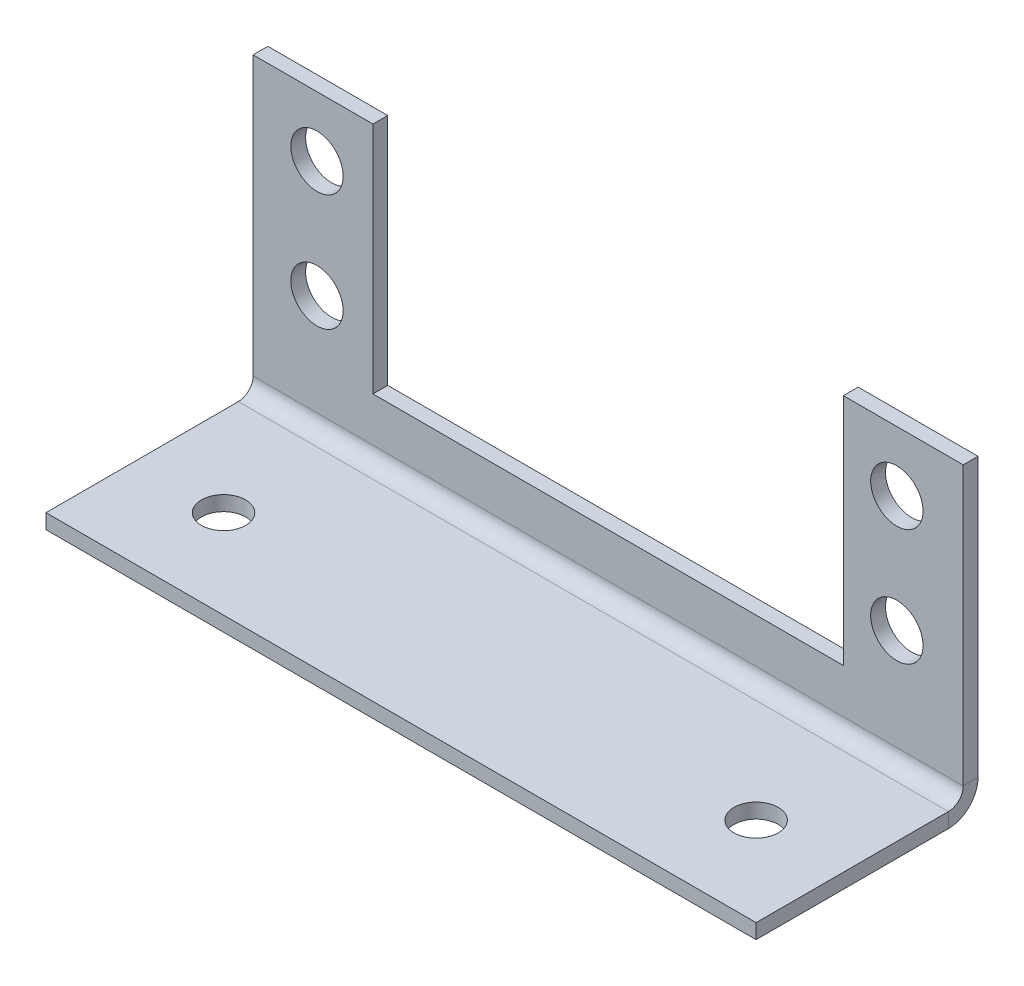
from build123d import *

# Parameters (mm, degrees)
BOSS_EXTRUDE1_DEPTH    = 60.96
CONVERT_SOLID1_DEPTH   = 60.96
CONVERT_SOLID1_2_DEPTH = 60.96
SKETCH6_W              = 40.386
SKETCH6_H              = 20.066
CUT_EXTRUDE1_DEPTH     = 71.995158286
SKETCH8_R              = 1.89865
CUT_EXTRUDE2_DEPTH     = 71.767609116
SKETCH9_R              = 2.2479
CUT_EXTRUDE3_DEPTH     = 71.995158286
CUT_EXTRUDE4_DEPTH     = 71.995158286


# Read off the part's stored shape, not the designer's step: Convert-Solid1
with BuildPart() as part:
    # Sketch1 → Boss-Extrude1 (new body)
    with BuildSketch(Plane(origin=(0, 0, 0), x_dir=(0, 0, -1), z_dir=(1, 0, 0))):
        Polygon((0, 0), (19.05, 0), (19.05, 31.75), (17.78, 31.75), (17.78, 1.27), (0, 1.27), align=None)
    extrude(amount=BOSS_EXTRUDE1_DEPTH)

    # Convert-Solid1 outline → Convert-Solid1 (cut)
    with BuildSketch(Plane.YZ):
        with BuildLine():
            ThreePointArc((2.54, -19.05), (0.743948776, -18.306051224), (0, -16.51))
            Line((0, -16.51), (0, -19.05))
            Line((0, -19.05), (2.54, -19.05))
        make_face()
    extrude(amount=CONVERT_SOLID1_DEPTH, mode=Mode.SUBTRACT)

    # Convert-Solid1 2 outline → Convert-Solid1 2 (add)
    with BuildSketch(Plane.YZ):
        with BuildLine():
            ThreePointArc((2.54, -17.78), (1.641974388, -17.408025612), (1.27, -16.51))
            Line((1.27, -16.51), (1.27, -17.78))
            Line((1.27, -17.78), (2.54, -17.78))
        make_face()
    extrude(amount=CONVERT_SOLID1_2_DEPTH)

    # Sketch6 → Cut-Extrude1 (cut, through all)
    with BuildSketch(Plane.XY.offset(-17.78)):
        with Locations((30.48, 16.383)):
            Rectangle(SKETCH6_W, SKETCH6_H)
    extrude(amount=-CUT_EXTRUDE1_DEPTH, mode=Mode.SUBTRACT)

    # Sketch8 → Cut-Extrude2 (cut, through all)
    with BuildSketch(Plane(origin=(0, 1.27, 0), x_dir=(1, 0, 0), z_dir=(0, 1, 0))):
        with Locations(Location((7.62, 7.62, 0), (0, 0, 270))):
            Circle(SKETCH8_R)
        with Locations(Location((53.34, 7.62, 0), (0, 0, 270))):
            Circle(SKETCH8_R)
    extrude(amount=-CUT_EXTRUDE2_DEPTH, mode=Mode.SUBTRACT)

    # Sketch9 → Cut-Extrude3 (cut, through all)
    with BuildSketch(Plane.XY.offset(-17.78)):
        with Locations((5.483386699, 21.25)):
            Circle(SKETCH9_R)
        with Locations((5.483386699, 11.25)):
            Circle(SKETCH9_R)
        with Locations((55.262613301, 21.25)):
            Circle(SKETCH9_R)
        with Locations((55.262613301, 11.25)):
            Circle(SKETCH9_R)
    extrude(amount=-CUT_EXTRUDE3_DEPTH, mode=Mode.SUBTRACT)

    # Sketch10 → Cut-Extrude4 (cut, through all)
    with BuildSketch(Plane.XY.offset(-17.78)):
        Polygon((0, 26.416), (60.96, 26.416), (69.305073622, 29.055582779), (66.812292009, 41.145573602), (-9.342186268, 39.525265553), (-7.97115638, 29.055582779), (-7.223321897, 29.055582779), align=None)
    extrude(amount=-CUT_EXTRUDE4_DEPTH, mode=Mode.SUBTRACT)


solid = part.part
